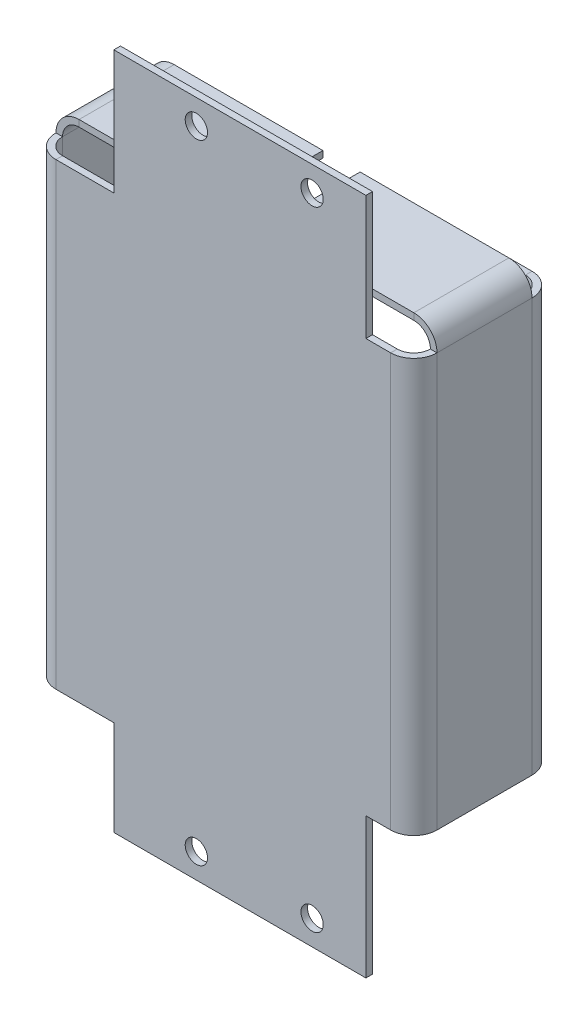
from build123d import *

# Parameters (mm, degrees)
SKETCH1_R                      = 1.35
BASE_FLANGE1_DEPTH             = 0.8
EDGE_FLANGE1_STRIP_W           = 7.2
EDGE_FLANGE1_STRIP_H           = 0.8
EDGE_FLANGE1_STRIP_CUT_DEPTH   = 50
EDGE_FLANGE1_STRIP_2_W         = 7.2
EDGE_FLANGE1_STRIP_2_H         = 0.8
EDGE_FLANGE1_STRIP_CUT_2_DEPTH = 55.5
EDGE_FLANGE1_DEPTH             = 50
EDGE_FLANGE1_BEND_DEPTH        = 55.5
EDGE_FLANGE4_DEPTH             = 11.5
EDGE_FLANGE4_BEND_DEPTH        = 11.5
EDGE_FLANGE5_DEPTH             = 50
EDGE_FLANGE5_BEND_DEPTH        = 55.5


# Sheet-metal steps are written as plain solids
with BuildPart() as part:
    # Sketch1 → Base-Flange1 (new body)
    with BuildSketch(Plane.XY):
        Polygon((16.25, 0), (16.25, -17), (-14.25, -17), (-14.25, -5.5), (-23.25, -5.5), (-23.25, 50), (-14.25, 50), (-14.25, 65), (16.25, 65), (16.25, 50), (21.25, 50), (21.25, 0), align=None)
        with Locations((9.737756115, -14)):
            Circle(SKETCH1_R, mode=Mode.SUBTRACT)
        with Locations((-4.262243885, -14)):
            Circle(SKETCH1_R, mode=Mode.SUBTRACT)
        with Locations((9.737756115, 62)):
            Circle(SKETCH1_R, mode=Mode.SUBTRACT)
        with Locations((-4.262243885, 62)):
            Circle(SKETCH1_R, mode=Mode.SUBTRACT)
    extrude(amount=BASE_FLANGE1_DEPTH)

    # Edge-Flange1 strip (across the edge) → Edge-Flange1 strip cut (cut)
    with BuildSketch(Plane(origin=(21.25, 50, 0), x_dir=(-1, 0, 0), z_dir=(0, -1, 0))):
        with Locations((-1.6, -0.4)):
            Rectangle(EDGE_FLANGE1_STRIP_W, EDGE_FLANGE1_STRIP_H)
    extrude(amount=EDGE_FLANGE1_STRIP_CUT_DEPTH, mode=Mode.SUBTRACT)

    # Edge-Flange1 strip 2 (across the edge) → Edge-Flange1 strip cut 2 (cut)
    with BuildSketch(Plane(origin=(-23.25, -5.5, 0), x_dir=(1, 0, 0), z_dir=(0, 1, 0))):
        with Locations((-1.6, -0.4)):
            Rectangle(EDGE_FLANGE1_STRIP_2_W, EDGE_FLANGE1_STRIP_2_H)
    extrude(amount=EDGE_FLANGE1_STRIP_CUT_2_DEPTH, mode=Mode.SUBTRACT)

    # Edge-Flange1 section (across the edge) → Edge-Flange1 (add)
    with BuildSketch(Plane(origin=(21.25, 50, 0), x_dir=(-1, 0, 0), z_dir=(0, -1, 0))):
        with BuildLine():
            Line((-0.8, 2), (-0.8, 13.5))
            Line((-0.8, 13.5), (0, 13.5))
            Line((0, 13.5), (0, 2))
            ThreePointArc((0, 2), (0.585786438, 0.585786438), (2, 0))
            Line((2, 0), (2, -0.8))
            ThreePointArc((2, -0.8), (0.020101013, 0.020101013), (-0.8, 2))
        make_face()
    extrude(amount=EDGE_FLANGE1_DEPTH)

    # Edge-Flange1 section 2 (across the edge) → Edge-Flange1 bend (add)
    with BuildSketch(Plane(origin=(-23.25, -5.5, 0), x_dir=(1, 0, 0), z_dir=(0, 1, 0))):
        with BuildLine():
            Line((-0.8, 2), (-0.8, 13.5))
            Line((-0.8, 13.5), (0, 13.5))
            Line((0, 13.5), (0, 2))
            ThreePointArc((0, 2), (0.585786438, 0.585786438), (2, 0))
            Line((2, 0), (2, -0.8))
            ThreePointArc((2, -0.8), (0.020101013, 0.020101013), (-0.8, 2))
        make_face()
    extrude(amount=EDGE_FLANGE1_BEND_DEPTH)

    # Edge-Flange4 section (across the edge) → Edge-Flange4 (add)
    with BuildSketch(Plane(origin=(21.25, 52, -2), x_dir=(0, -1, 0), z_dir=(0, 0, -1))):
        with BuildLine():
            Line((-0.8, 2), (-0.8, 20))
            Line((-0.8, 20), (0, 20))
            Line((0, 20), (0, 2))
            ThreePointArc((0, 2), (0.585786438, 0.585786438), (2, 0))
            Line((2, 0), (2, -0.8))
            ThreePointArc((2, -0.8), (0.020101013, 0.020101013), (-0.8, 2))
        make_face()
    extrude(amount=EDGE_FLANGE4_DEPTH)

    # Edge-Flange4 section 2 (across the edge) → Edge-Flange4 bend (add)
    with BuildSketch(Plane(origin=(-23.25, 52, -13.5), x_dir=(0, -1, 0), z_dir=(0, 0, 1))):
        with BuildLine():
            Line((-0.8, 2), (-0.8, 20))
            Line((-0.8, 20), (0, 20))
            Line((0, 20), (0, 2))
            ThreePointArc((0, 2), (0.585786438, 0.585786438), (2, 0))
            Line((2, 0), (2, -0.8))
            ThreePointArc((2, -0.8), (0.020101013, 0.020101013), (-0.8, 2))
        make_face()
    extrude(amount=EDGE_FLANGE4_BEND_DEPTH)

    # Edge-Flange5 section (across the edge) → Edge-Flange5 (add)
    with BuildSketch(Plane(origin=(21.25, 50, -15.5), x_dir=(0, 0, 1), z_dir=(0, -1, 0))):
        with BuildLine():
            Line((-0.8, 2), (-0.8, 10))
            Line((-0.8, 10), (0, 10))
            Line((0, 10), (0, 2))
            ThreePointArc((0, 2), (0.585786438, 0.585786438), (2, 0))
            Line((2, 0), (2, -0.8))
            ThreePointArc((2, -0.8), (0.020101013, 0.020101013), (-0.8, 2))
        make_face()
    extrude(amount=EDGE_FLANGE5_DEPTH)

    # Edge-Flange5 section 2 (across the edge) → Edge-Flange5 bend (add)
    with BuildSketch(Plane(origin=(-23.25, -5.5, -15.5), x_dir=(0, 0, 1), z_dir=(0, 1, 0))):
        with BuildLine():
            Line((-0.8, 2), (-0.8, 10))
            Line((-0.8, 10), (0, 10))
            Line((0, 10), (0, 2))
            ThreePointArc((0, 2), (0.585786438, 0.585786438), (2, 0))
            Line((2, 0), (2, -0.8))
            ThreePointArc((2, -0.8), (0.020101013, 0.020101013), (-0.8, 2))
        make_face()
    extrude(amount=EDGE_FLANGE5_BEND_DEPTH)


solid = part.part
